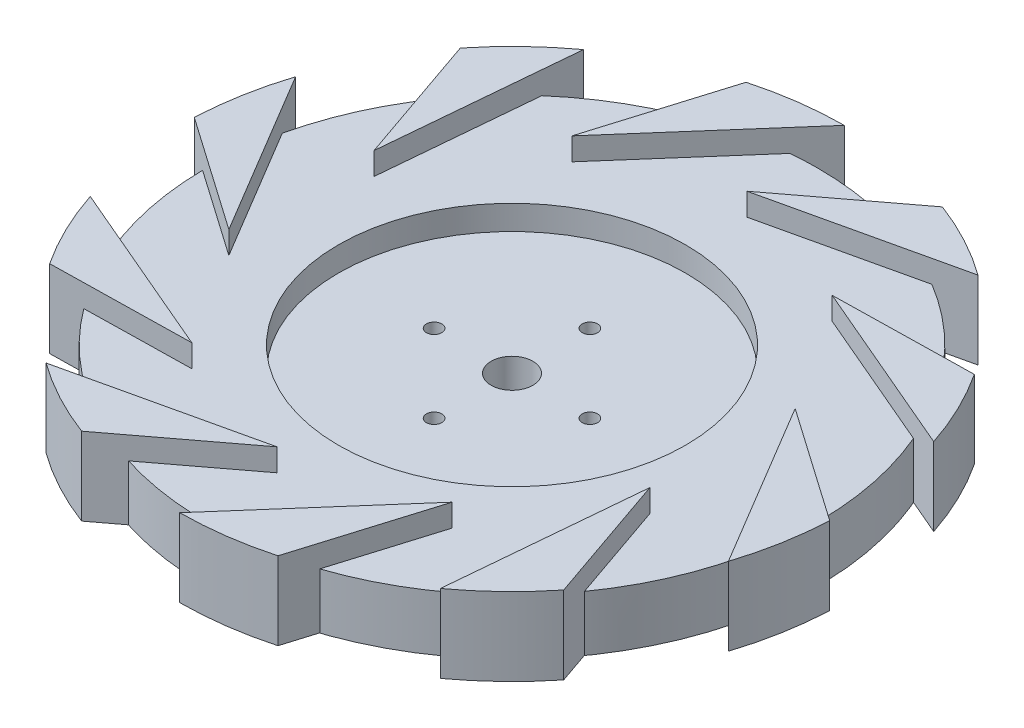
from build123d import *

# Parameters (mm, degrees)
GUIDE_START        = 3.429
GUIDE_VANES_DEPTH  = 17.78
CIRPATTERN4_COUNT  = 10
SKETCH6_R          = 1.7526
CUT_EXTRUDE1_DEPTH = 13.97
CIRPATTERN5_COUNT  = 4
SKETCH9_R          = 4.7625
CUT_EXTRUDE2_DEPTH = 7.62


with BuildPart() as part:
    # Sketch3 → Body (revolve)
    with BuildSketch(Plane.XY):
        Polygon((-69.85, 16.0734375), (-39.624, 16.0734375), (-39.624, 10.4854375), (0, 10.4854375), (0, 3.3734375), (-69.85, 3.3734375), align=None)
    revolve(axis=Axis((0, 0, 0), (0, 1, 0)))

    # Sketch4 → Guide Vanes (add)
    with BuildSketch(Plane(origin=(0, 0, 0), x_dir=(1, 0, 0), z_dir=(0, 1, 0)).offset(GUIDE_START)):
        with BuildLine():
            Line((1.553349961, 52.076946284), (26.95018459, 71.275013508))
            ThreePointArc((26.95018459, 71.275013508), (36.029244063, 67.144125374), (44.490941148, 61.862720242))
            Line((44.490941148, 61.862720242), (1.553349961, 52.076946284))
        make_face()
    guide_vanes = extrude(amount=GUIDE_VANES_DEPTH)

    # CirPattern4: Guide Vanes ×10 about axis
    cirpattern4_axis = Axis((0, 16.0734375, 0), (0, -1, 0))
    for i in range(1, CIRPATTERN4_COUNT):
        add(guide_vanes.rotate(cirpattern4_axis, i * 360 / CIRPATTERN4_COUNT))

    # Sketch6 → Cut-Extrude1 (cut)
    with BuildSketch(Plane(origin=(0, 0, 0), x_dir=(1, 0, 0), z_dir=(0, 1, 0))):
        with Locations((0, 17.78)):
            Circle(SKETCH6_R)
    cut_extrude1 = extrude(amount=CUT_EXTRUDE1_DEPTH, mode=Mode.SUBTRACT)

    # CirPattern5: Cut-Extrude1 ×4 about axis
    cirpattern5_axis = Axis((0, 16.0734375, 0), (0, -1, 0))
    for i in range(1, CIRPATTERN5_COUNT):
        add(cut_extrude1.rotate(cirpattern5_axis, i * 360 / CIRPATTERN5_COUNT), mode=Mode.SUBTRACT)

    # Sketch9 → Cut-Extrude2 (cut)
    with BuildSketch(Plane(origin=(0, 10.4854375, 0), x_dir=(1, 0, 0), z_dir=(0, 1, 0))):
        Circle(SKETCH9_R)
    extrude(amount=-CUT_EXTRUDE2_DEPTH, mode=Mode.SUBTRACT)


solid = part.part
